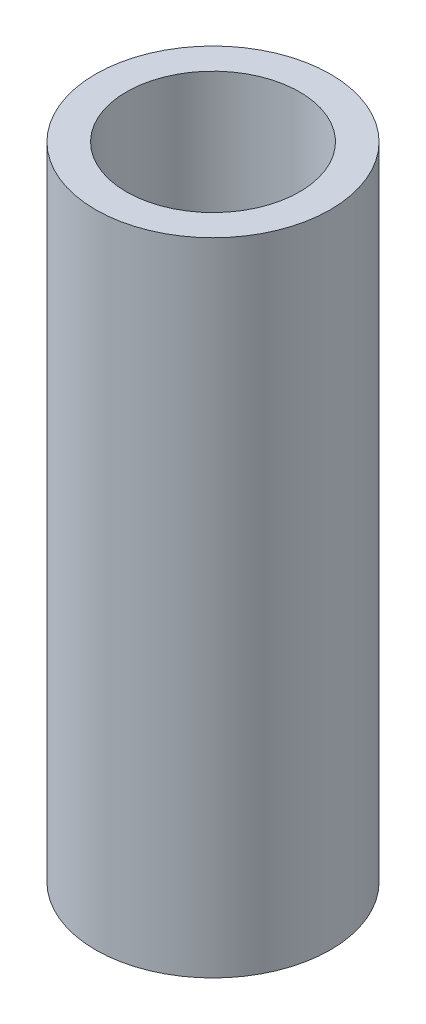
from build123d import *

# Parameters (mm, degrees)
SKETCH1_R           = 17.5
BOSS_EXTRUDE1_DEPTH = 95.535979763
SKETCH2_R           = 12.908518131
CUT_EXTRUDE1_DEPTH  = 99.689530495


with BuildPart() as part:
    # Sketch1 → Boss-Extrude1 (new body)
    with BuildSketch(Plane(origin=(0, 0, 0), x_dir=(1, 0, 0), z_dir=(0, 1, 0))):
        Circle(SKETCH1_R)
    extrude(amount=BOSS_EXTRUDE1_DEPTH)

    # Sketch2 → Cut-Extrude1 (cut, through all)
    with BuildSketch(Plane(origin=(0, 0, 0), x_dir=(1, 0, 0), z_dir=(0, 1, 0))):
        Circle(SKETCH2_R)
    extrude(amount=CUT_EXTRUDE1_DEPTH, mode=Mode.SUBTRACT)


solid = part.part
